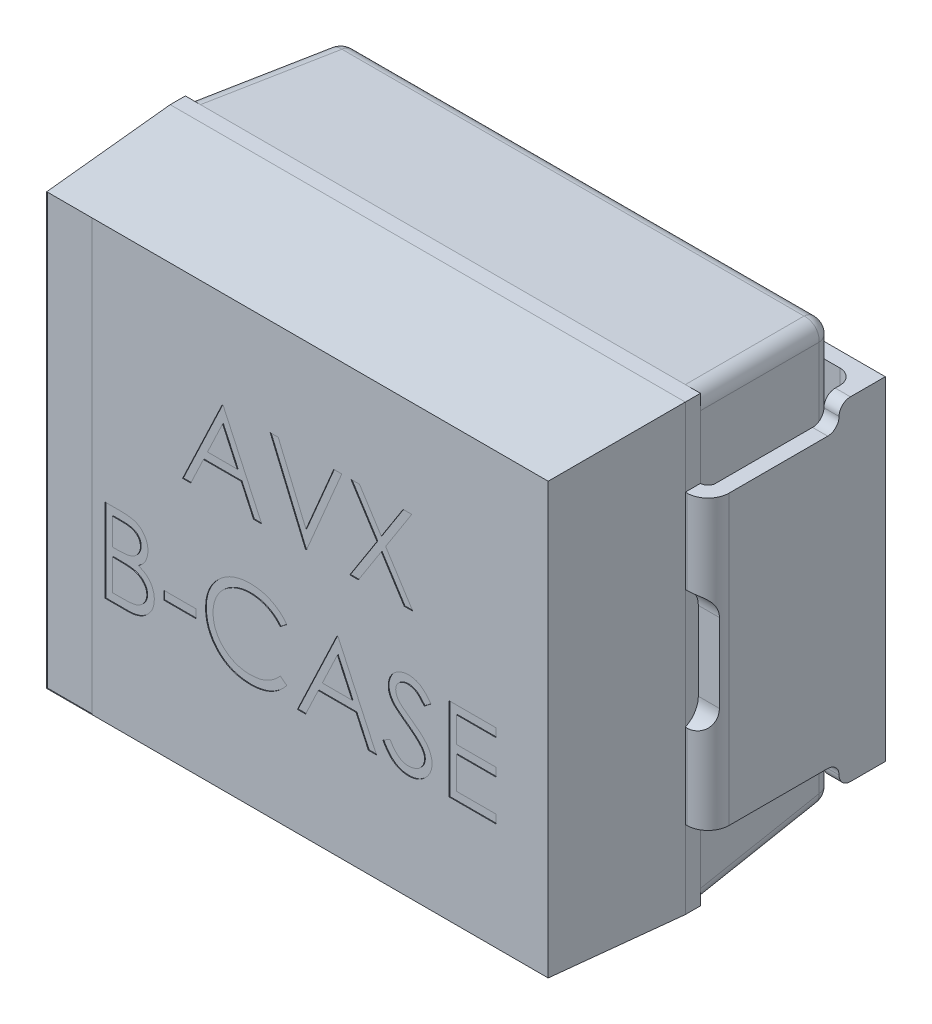
from build123d import *

# Parameters (mm, degrees)
BOSS_EXTRUDE1_START = 0.12
SKETCH1_W           = 3.4
SKETCH1_H           = 2.93
BOSS_EXTRUDE1_DEPTH = 0.95
CHAMFER3_SIZE       = 0.95
CHAMFER3_SIZE_2     = 0.08311423
FILLET4_R           = 0.1
SKETCH2_W           = 3.4
SKETCH2_H           = 2.93
BOSS_EXTRUDE2_DEPTH = 0.1
SKETCH3_W           = 3.4
SKETCH3_H           = 2.93
BOSS_EXTRUDE3_DEPTH = 0.86
BOSS_EXTRUDE3_TAPER = 3
BOSS_EXTRUDE4_START = 0.02
SKETCH4_W           = 1.4
SKETCH4_H           = 2.5
BOSS_EXTRUDE4_DEPTH = 0.1
FILLET5_R           = 0.1
BOSS_EXTRUDE5_DEPTH = 1.1
CUT_EXTRUDE3_DEPTH  = 0.15
CUT_EXTRUDE6_DEPTH  = 0.15
SKETCH15_W          = 0.211538461
SKETCH15_H          = 0.056410256
CUT_EXTRUDE7_DEPTH  = 0.005
SKETCH16_W          = 0.3
SKETCH16_H          = 2.83985862
CUT_EXTRUDE8_DEPTH  = 0.005


# Some blends are built 0.0001 mm under size
with BuildPart() as part:
    # Sketch1 → Boss-Extrude1 (new body)
    with BuildSketch(Plane.XY.offset(BOSS_EXTRUDE1_START)):
        Rectangle(SKETCH1_W, SKETCH1_H)
    extrude(amount=BOSS_EXTRUDE1_DEPTH)

    # Chamfer3
    # the kernel refuses this chamfer: 0.95, 0.08311423 mm, written as the material it takes off along each edge
    with BuildSketch(Plane(origin=(4.169652376, -1.465, 0.12), x_dir=(0, -0.0033526157940331914, 0.9999943799678764), z_dir=(-1, 0, 0)), Plane(origin=(-4.169652376, 1.465, 0.12), x_dir=(0, 0.0033526157940331914, 0.9999943799678764), z_dir=(1, 0, 0))) as chamfer3_piece_1:
        Polygon((CHAMFER3_SIZE * 0.999994379968, CHAMFER3_SIZE * 0.00335261579403), (-CHAMFER3_SIZE_2 * 0.00335261580814, CHAMFER3_SIZE_2 * 0.999994384174), (0, 0), align=None)
    extrude(amount=8.339304752, mode=Mode.SUBTRACT)
    with BuildSketch(Plane(origin=(1.7, 3.934652376, 0.12), x_dir=(0.0033526157940331914, 0, 0.9999943799678764), z_dir=(0, -1, 0)), Plane(origin=(-1.7, -3.934652376, 0.12), x_dir=(-0.0033526157940331914, 0, 0.9999943799678764), z_dir=(0, 1, 0))) as chamfer3_piece_2:
        Polygon((CHAMFER3_SIZE * 0.999994379968, CHAMFER3_SIZE * 0.00335261579403), (-CHAMFER3_SIZE_2 * 0.00335261580814, CHAMFER3_SIZE_2 * 0.999994384174), (0, 0), align=None)
    extrude(amount=7.869304752, mode=Mode.SUBTRACT)

    # Fillet4
    fillet4_edges = [part.edges().sort_by_distance(p)[0] for p in [
        (-1.61688577, 0, 0.12),
        (0, 1.38188577, 0.12),
        (1.61688577, 0, 0.12),
        (0, -1.38188577, 0.12),
        (-1.658442885, 1.423442885, 0.595),
        (1.658442885, 1.423442885, 0.595),
        (-1.658442885, -1.423442885, 0.595),
        (1.658442885, -1.423442885, 0.595),
    ]]
    fillet(fillet4_edges, radius=FILLET4_R)

    # Sketch2 → Boss-Extrude2 (add)
    with BuildSketch(Plane.XY.offset(1.07)):
        Rectangle(SKETCH2_W, SKETCH2_H)
    extrude(amount=BOSS_EXTRUDE2_DEPTH)

    # Sketch3 → Boss-Extrude3 (add)
    with BuildSketch(Plane.XY.offset(1.17)):
        Rectangle(SKETCH3_W, SKETCH3_H)
    extrude(amount=BOSS_EXTRUDE3_DEPTH, taper=BOSS_EXTRUDE3_TAPER)

    # Sketch4 → Boss-Extrude4 (add)
    with BuildSketch(Plane.XY.offset(BOSS_EXTRUDE4_START)):
        Rectangle(SKETCH4_W, SKETCH4_H)
    extrude(amount=BOSS_EXTRUDE4_DEPTH)

    # Fillet5
    fillet5_edges = [part.edges().sort_by_distance(p)[0] for p in [
        (0, -1.25, 0.02),
        (0.7, 0, 0.02),
        (0, 1.25, 0.02),
        (-0.7, 0, 0.02),
    ]]
    fillet(fillet5_edges, radius=FILLET5_R - 0.0001)  # a hair under: the kernel refuses the full size

    # Sketch6 → Boss-Extrude5 (add, symmetric)
    with BuildSketch(Plane(origin=(0, 0, 0), x_dir=(1, 0, 0), z_dir=(0, 1, 0))):
        with BuildLine():
            Line((-1.7, -1.17), (-1.7, -1.07))
            ThreePointArc((-1.7, -1.07), (-1.735648232, -1.055648232), (-1.75, -1.021))
            Line((-1.75, -1.021), (-1.75, -0.2))
            ThreePointArc((-1.75, -0.2), (-1.720710678, -0.129289322), (-1.65, -0.1))
            Line((-1.65, -0.1), (-1.15, -0.1))
            Line((-1.15, -0.1), (-1.15, 0))
            Line((-1.15, 0), (-1.85, 0))
            Line((-1.85, 0), (-1.85, -1.03))
            ThreePointArc((-1.85, -1.03), (-1.808994949, -1.128994949), (-1.71, -1.17))
            Line((-1.71, -1.17), (-1.7, -1.17))
        make_face()
        with BuildLine():
            Line((1.71, -1.17), (1.7, -1.17))
            Line((1.7, -1.17), (1.7, -1.07))
            ThreePointArc((1.7, -1.07), (1.735648232, -1.055648232), (1.75, -1.021))
            Line((1.75, -1.021), (1.75, -0.2))
            ThreePointArc((1.75, -0.2), (1.720710678, -0.129289322), (1.65, -0.1))
            Line((1.65, -0.1), (1.15, -0.1))
            Line((1.15, -0.1), (1.15, 0))
            Line((1.15, 0), (1.85, 0))
            Line((1.85, 0), (1.85, -1.03))
            ThreePointArc((1.85, -1.03), (1.808994949, -1.128994949), (1.71, -1.17))
        make_face()
    extrude(amount=BOSS_EXTRUDE5_DEPTH, both=True)

    # Sketch7 → Cut-Extrude3 (cut)
    with BuildSketch(Plane.ZY.offset(1.85)):
        with BuildLine():
            Line((1.17, 0.475), (0.559, 0.475))
            ThreePointArc((0.559, 0.475), (0.488289322, 0.445710678), (0.459, 0.375))
            Line((0.459, 0.375), (0.459, -0.375))
            ThreePointArc((0.459, -0.375), (0.488289322, -0.445710678), (0.559, -0.475))
            Line((0.559, -0.475), (1.17, -0.475))
            Line((1.17, -0.475), (1.17, 0.475))
        make_face()
    extrude(amount=-CUT_EXTRUDE3_DEPTH, mode=Mode.SUBTRACT)

    # Sketch11 → Cut-Extrude6 (cut)
    with BuildSketch(Plane(origin=(1.7, 0, -3.478843465), x_dir=(0, 0, 1), z_dir=(-1, 0, 0))):
        with BuildLine():
            Line((4.648843465, -1.1), (3.708843465, -1.1))
            ThreePointArc((3.708843465, -1.1), (3.761876473, -1.078033009), (3.783843465, -1.025))
            ThreePointArc((3.783843465, -1.025), (3.805810456, -0.971966991), (3.858843465, -0.95))
            Line((3.858843465, -0.95), (4.648843465, -0.95))
            Line((4.648843465, -0.95), (4.648843465, -1.1))
        make_face()
        with BuildLine():
            Line((4.64771858, 0.392975458), (4.648843465, 0.3935))
            Line((4.648843465, 0.3935), (4.648843465, -0.3935))
            Line((4.648843465, -0.3935), (4.64771858, -0.392975458))
            ThreePointArc((4.64771858, -0.392975458), (4.585864922, -0.338731255), (4.562843465, -0.259748213))
            Line((4.562843465, -0.259748213), (4.562843465, 0.259748213))
            ThreePointArc((4.562843465, 0.259748213), (4.585864922, 0.338731255), (4.64771858, 0.392975458))
        make_face()
        with BuildLine():
            Line((3.858843465, 0.95), (4.648843465, 0.95))
            Line((4.648843465, 0.95), (4.648843465, 1.1))
            Line((4.648843465, 1.1), (3.708843465, 1.1))
            ThreePointArc((3.708843465, 1.1), (3.761876473, 1.078033009), (3.783843465, 1.025))
            ThreePointArc((3.783843465, 1.025), (3.805810456, 0.971966991), (3.858843465, 0.95))
        make_face()
    extrude(amount=-CUT_EXTRUDE6_DEPTH, mode=Mode.SUBTRACT)

    # Sketch15 → Cut-Extrude7 (cut)
    # profile 1 of 9: a face of its own
    with BuildSketch(Plane.XY.offset(2.03)):
        Polygon((-0.490064103, 0.780007225), (-0.236217949, 0.230007225), (-0.289873798, 0.230007225), (-0.371183894, 0.406289277), (-0.620512821, 0.406289277), (-0.704136619, 0.230007225), (-0.758012821, 0.230007225), (-0.497115385, 0.780007225), align=None)
        Polygon((-0.494140625, 0.672805703), (-0.593739984, 0.462699533), (-0.397185497, 0.462699533), align=None, mode=Mode.SUBTRACT)
    # profile 2 of 9: a face of its own
    with BuildSketch(Plane.XY.offset(2.03)):
        Polygon((-0.179807692, 0.780007225), (-0.126923077, 0.780007225), (0.056410256, 0.346573732), (0.23974359, 0.780007225), (0.292628205, 0.780007225), (0.059935897, 0.230007225), (0.052884615, 0.230007225), align=None)
    # profile 3 of 9: a face of its own
    with BuildSketch(Plane.XY.offset(2.03)):
        Polygon((0.352564103, 0.780007225), (0.40952524, 0.780007225), (0.553525641, 0.555027257), (0.697526042, 0.780007225), (0.754487179, 0.780007225), (0.582061298, 0.510516039), (0.761538462, 0.230007225), (0.704577324, 0.230007225), (0.553525641, 0.466004821), (0.402473958, 0.230007225), (0.345512821, 0.230007225), (0.52510016, 0.510516039), align=None)
    # profile 4 of 9: a face of its own
    with BuildSketch(Plane.XY.offset(2.03)):
        with BuildLine():
            Line((-1.269230769, -0.161659441), (-1.161919071, -0.161659441))
            add(Edge.make_bspline(
                [(-1.161919071, -0.161659441), (-1.156666024, -0.161687059), (-1.146484312, -0.16174059), (-1.1316784, -0.162570796), (-1.11781073, -0.163702801), (-1.10487728, -0.165498959), (-1.092884027, -0.167666238), (-1.081794826, -0.170290809), (-1.071644942, -0.173437848), (-1.059527227, -0.178442264), (-1.045711123, -0.185878762), (-1.030751375, -0.196867536), (-1.017959281, -0.210308352), (-1.006930002, -0.225469912), (-0.998161255, -0.242148391), (-0.991817508, -0.259946263), (-0.98780127, -0.278633965), (-0.987388231, -0.291463608), (-0.987179487, -0.297947502)],
                knots=[0, 0, 0, 0, 1.001505555, 1.941167018, 2.826882275, 3.653841531, 4.429895133, 5.150066043, 5.825578002, 6.45369114, 7.647487171, 8.808567382, 9.977351308, 11.170798116, 12.373658725, 13.556498008, 14.765093433, 16, 16, 16, 16], degree=3))
            add(Edge.make_bspline(
                [(-0.987179487, -0.297947502), (-0.987351279, -0.304021475), (-0.987688865, -0.315957405), (-0.990917013, -0.333415051), (-0.995970832, -0.3500331), (-1.002995943, -0.365750903), (-1.012126257, -0.380213328), (-1.02294685, -0.393537041), (-1.036001776, -0.405157922), (-1.045782856, -0.411654663), (-1.050751202, -0.414954714)],
                knots=[0, 0, 0, 0, 1.044552857, 2.05264487, 3.044412934, 4.028983338, 5.005914585, 5.980388656, 6.974128949, 8, 8, 8, 8], degree=3))
            add(Edge.make_bspline(
                [(-1.050751202, -0.414954714), (-1.044503135, -0.417353499), (-1.032549034, -0.42194297), (-1.016098375, -0.430057115), (-1.0019249, -0.438882589), (-0.989919634, -0.448520451), (-0.979652288, -0.458908979), (-0.970686826, -0.470200497), (-0.963036896, -0.482542302), (-0.956482008, -0.495805714), (-0.951367203, -0.509855302), (-0.947536704, -0.524559281), (-0.945341819, -0.539864926), (-0.945029475, -0.5502812), (-0.944871795, -0.55553965)],
                knots=[0, 0, 0, 0, 1.27268992, 2.434971085, 3.483601985, 4.442670788, 5.356604649, 6.2567628, 7.179492994, 8.113709626, 9.066344395, 10.018646069, 10.999752585, 12, 12, 12, 12], degree=3))
            add(Edge.make_bspline(
                [(-0.944871795, -0.55553965), (-0.945025299, -0.56090873), (-0.945327323, -0.571472545), (-0.947555605, -0.586991209), (-0.951328464, -0.601821558), (-0.956525359, -0.616059515), (-0.963308008, -0.629677536), (-0.971562403, -0.642691049), (-0.981404505, -0.654969301), (-0.992414385, -0.666648727), (-1.004869865, -0.677150237), (-1.018308055, -0.686502705), (-1.032898191, -0.694194229), (-1.048400647, -0.700655318), (-1.064989325, -0.705590735), (-1.082589735, -0.709043568), (-1.101186697, -0.711370074), (-1.113948229, -0.711561349), (-1.120492788, -0.711659441)],
                knots=[0, 0, 0, 0, 0.978564426, 1.925352924, 2.850884081, 3.763762016, 4.682927383, 5.618979971, 6.567305752, 7.547517671, 8.540179244, 9.531824382, 10.526200242, 11.540722885, 12.589160233, 13.674978461, 14.80764778, 16, 16, 16, 16], degree=3))
            Line((-1.120492788, -0.711659441), (-1.269230769, -0.711659441))
            Line((-1.269230769, -0.711659441), (-1.269230769, -0.161659441))
        make_face()
        with BuildLine():
            Line((-1.219871795, -0.218069698), (-1.219871795, -0.394351749))
            Line((-1.219871795, -0.394351749), (-1.186708734, -0.394351749))
            add(Edge.make_bspline(
                [(-1.186708734, -0.394351749), (-1.181861066, -0.394288904), (-1.172494384, -0.394167475), (-1.158929829, -0.393819636), (-1.146338755, -0.392845658), (-1.134742895, -0.39187196), (-1.124160511, -0.39028881), (-1.114615047, -0.388404334), (-1.105956696, -0.386411306), (-1.09597191, -0.383021815), (-1.084646161, -0.378012466), (-1.072572388, -0.37023832), (-1.0619284, -0.360978779), (-1.05294027, -0.350294485), (-1.045584182, -0.338529799), (-1.040474884, -0.325872432), (-1.037010311, -0.31263784), (-1.036697356, -0.303552114), (-1.036538462, -0.298939089)],
                knots=[0, 0, 0, 0, 1.156816544, 2.235205308, 3.236616184, 4.169592532, 5.011045266, 5.787822928, 6.49130361, 7.128639758, 8.301311294, 9.436451833, 10.541879658, 11.654887649, 12.756523258, 13.837046038, 14.901820046, 16, 16, 16, 16], degree=3))
            add(Edge.make_bspline(
                [(-1.036538462, -0.298939089), (-1.036621147, -0.295886468), (-1.036783344, -0.289898418), (-1.03811172, -0.281169233), (-1.040369481, -0.272959501), (-1.043269442, -0.265156712), (-1.04732195, -0.25800485), (-1.052093351, -0.251256634), (-1.057858246, -0.245141872), (-1.064420109, -0.239426665), (-1.071964321, -0.234359668), (-1.080486381, -0.229921834), (-1.090101588, -0.226348283), (-1.100647893, -0.223218602), (-1.112287636, -0.221020442), (-1.124886494, -0.219189195), (-1.138547664, -0.218256907), (-1.147999038, -0.218133493), (-1.152884615, -0.218069698)],
                knots=[0, 0, 0, 0, 0.91205012, 1.789085906, 2.630437955, 3.453916878, 4.269457761, 5.079663411, 5.91843418, 6.774407191, 7.675494373, 8.627863946, 9.638891023, 10.736472738, 11.911756761, 13.175263542, 14.539845004, 16, 16, 16, 16], degree=3))
            Line((-1.152884615, -0.218069698), (-1.219871795, -0.218069698))
        make_face(mode=Mode.SUBTRACT)
        with BuildLine():
            Line((-1.219871795, -0.450762006), (-1.219871795, -0.655249185))
            Line((-1.219871795, -0.655249185), (-1.149579327, -0.655249185))
            add(Edge.make_bspline(
                [(-1.149579327, -0.655249185), (-1.144547781, -0.655188882), (-1.134850141, -0.655072655), (-1.120848519, -0.654693225), (-1.107871174, -0.653830154), (-1.095977324, -0.65247152), (-1.085038539, -0.650997764), (-1.075186043, -0.649015991), (-1.066339969, -0.64674544), (-1.056082578, -0.643235784), (-1.044532027, -0.637783482), (-1.032084606, -0.629562675), (-1.021017629, -0.619769012), (-1.01161966, -0.608434154), (-1.003917619, -0.596109231), (-0.998314619, -0.583043534), (-0.994858913, -0.569452951), (-0.994440572, -0.560186753), (-0.994230769, -0.55553965)],
                knots=[0, 0, 0, 0, 1.160039823, 2.235823828, 3.228722157, 4.157150951, 4.99529583, 5.772374946, 6.472645482, 7.099169577, 8.269452708, 9.405989375, 10.527446681, 11.663510218, 12.788923519, 13.866172445, 14.929861265, 16, 16, 16, 16], degree=3))
            add(Edge.make_bspline(
                [(-0.994230769, -0.55553965), (-0.994274157, -0.552633553), (-0.994360233, -0.546868236), (-0.995658329, -0.53839575), (-0.997546223, -0.530188827), (-0.999986877, -0.522225182), (-1.003541365, -0.514648795), (-1.007690965, -0.507309821), (-1.012556328, -0.50019856), (-1.020137554, -0.491208063), (-1.03116458, -0.480849675), (-1.046832788, -0.470708068), (-1.064648435, -0.462529127), (-1.077569898, -0.459056352), (-1.084244792, -0.457262406)],
                knots=[0, 0, 0, 0, 0.723448775, 1.435228256, 2.130040452, 2.821711965, 3.505591119, 4.210454504, 4.921174351, 5.648778258, 7.137944449, 8.670945889, 10.280296675, 12, 12, 12, 12], degree=3))
            add(Edge.make_bspline(
                [(-1.084244792, -0.457262406), (-1.086920792, -0.456719464), (-1.092722914, -0.455542255), (-1.102184105, -0.454299616), (-1.112985456, -0.453192535), (-1.125151908, -0.452373638), (-1.138698855, -0.451527182), (-1.153655228, -0.451197995), (-1.169959949, -0.450805255), (-1.181273036, -0.450776791), (-1.187149439, -0.450762006)],
                knots=[0, 0, 0, 0, 0.634451884, 1.375622551, 2.216452059, 3.157844607, 4.20941857, 5.370758133, 6.634282058, 8, 8, 8, 8], degree=3))
            Line((-1.187149439, -0.450762006), (-1.219871795, -0.450762006))
        make_face(mode=Mode.SUBTRACT)
    # profile 5 of 9: a face of its own
    with BuildSketch(Plane.XY.offset(2.03)):
        with Locations((-0.775641026, -0.50012098)):
            Rectangle(SKETCH15_W, SKETCH15_H)
    # profile 6 of 9: a face of its own
    with BuildSketch(Plane.XY.offset(2.03)):
        with BuildLine():
            Line((-0.070512821, -0.262580916), (-0.113701923, -0.2956338))
            add(Edge.make_bspline(
                [(-0.113701923, -0.2956338), (-0.116782848, -0.291962005), (-0.122903161, -0.284667918), (-0.132749608, -0.274425419), (-0.143011294, -0.264829449), (-0.153684299, -0.255834296), (-0.164960732, -0.247754519), (-0.176567429, -0.24016906), (-0.18869855, -0.233369844), (-0.205473823, -0.22512566), (-0.227418485, -0.216522693), (-0.255043388, -0.209309328), (-0.283880847, -0.204717429), (-0.303554755, -0.204220097), (-0.313561699, -0.203967134)],
                knots=[0, 0, 0, 0, 0.757959112, 1.505699292, 2.245454638, 2.979532153, 3.711538275, 4.438200793, 5.171680507, 5.909471876, 7.393775596, 8.890124382, 10.418191784, 12, 12, 12, 12], degree=3))
            add(Edge.make_bspline(
                [(-0.313561699, -0.203967134), (-0.319074789, -0.204030614), (-0.330049802, -0.204156984), (-0.346337419, -0.205824132), (-0.362320898, -0.208167322), (-0.377989843, -0.211644159), (-0.393324308, -0.216039856), (-0.408424543, -0.221292421), (-0.423071923, -0.227791039), (-0.437469074, -0.234973766), (-0.45126295, -0.24308665), (-0.464314458, -0.251935891), (-0.476575996, -0.261422463), (-0.488057263, -0.271581923), (-0.498769998, -0.282368516), (-0.508636575, -0.293897199), (-0.517622854, -0.306131112), (-0.525906958, -0.318908933), (-0.533326102, -0.332193443), (-0.53953794, -0.346033811), (-0.545038745, -0.360193027), (-0.549391483, -0.374831067), (-0.552836764, -0.38984493), (-0.555213969, -0.405274911), (-0.556862157, -0.421088775), (-0.556987899, -0.431807381), (-0.557051282, -0.437210323)],
                knots=[0, 0, 0, 0, 1.054917814, 2.100044995, 3.131103042, 4.146048494, 5.169673617, 6.183595914, 7.203665975, 8.234915748, 9.262203917, 10.264457458, 11.251630812, 12.227803204, 13.197192746, 14.159520551, 15.12972552, 16.100847026, 17.073214652, 18.039054194, 19.002613845, 19.979014051, 20.95965708, 21.949030935, 22.966165397, 24, 24, 24, 24], degree=3))
            add(Edge.make_bspline(
                [(-0.557051282, -0.437210323), (-0.556852996, -0.44533953), (-0.556463688, -0.461300151), (-0.55299895, -0.48467839), (-0.547733864, -0.507074495), (-0.539842845, -0.528348471), (-0.530112709, -0.548762641), (-0.517817755, -0.567971604), (-0.503578014, -0.586265635), (-0.487192033, -0.603212384), (-0.469213977, -0.618693113), (-0.449925019, -0.632325347), (-0.429373203, -0.643689114), (-0.407785446, -0.653145334), (-0.384995628, -0.660414249), (-0.361044731, -0.665531468), (-0.335984846, -0.668869525), (-0.318861083, -0.669189104), (-0.310146234, -0.669351749)],
                knots=[0, 0, 0, 0, 1.029171465, 2.020641659, 2.987623507, 3.938342917, 4.889210282, 5.84687017, 6.821220943, 7.821438502, 8.827599549, 9.822697543, 10.807740252, 11.797342354, 12.80366471, 13.83203677, 14.896651826, 16, 16, 16, 16], degree=3))
            add(Edge.make_bspline(
                [(-0.310146234, -0.669351749), (-0.300544383, -0.669086369), (-0.281645643, -0.668564039), (-0.253930667, -0.664139014), (-0.227399333, -0.656964198), (-0.202050212, -0.646923096), (-0.177954768, -0.633869979), (-0.155075292, -0.618046027), (-0.133392474, -0.599300718), (-0.12035413, -0.584987655), (-0.113701923, -0.577685082)],
                knots=[0, 0, 0, 0, 1.028121516, 2.023589091, 2.998037872, 3.967518031, 4.937445131, 5.927275754, 6.942489185, 8, 8, 8, 8], degree=3))
            Line((-0.113701923, -0.577685082), (-0.070512821, -0.610407438))
            add(Edge.make_bspline(
                [(-0.070512821, -0.610407438), (-0.073988523, -0.614892052), (-0.080923281, -0.623839799), (-0.092152398, -0.636453925), (-0.103981688, -0.648318844), (-0.116499013, -0.659338899), (-0.129560381, -0.669734601), (-0.143400315, -0.679210603), (-0.157836878, -0.687899171), (-0.172821153, -0.69585483), (-0.188337221, -0.702913255), (-0.204366489, -0.70895599), (-0.220839865, -0.714161329), (-0.237758102, -0.718443777), (-0.255156293, -0.721786375), (-0.272971653, -0.724020896), (-0.291242633, -0.725551768), (-0.303569142, -0.725691298), (-0.309815705, -0.725762006)],
                knots=[0, 0, 0, 0, 0.986787822, 1.968848986, 2.935600012, 3.899624008, 4.868462664, 5.837806735, 6.815139263, 7.798259679, 8.787526145, 9.778297419, 10.776456485, 11.791383307, 12.812564526, 13.85620153, 14.913611965, 16, 16, 16, 16], degree=3))
            add(Edge.make_bspline(
                [(-0.309815705, -0.725762006), (-0.315731139, -0.725720835), (-0.327428176, -0.725639426), (-0.344697979, -0.724320657), (-0.361510628, -0.722521413), (-0.377818069, -0.719812249), (-0.393709294, -0.716615281), (-0.409040243, -0.712329798), (-0.423961776, -0.707529215), (-0.438413944, -0.701887003), (-0.452409039, -0.695520174), (-0.465901924, -0.688324358), (-0.478886392, -0.680360065), (-0.491490101, -0.671802849), (-0.503526864, -0.662377844), (-0.515100989, -0.652215944), (-0.526277378, -0.6413514), (-0.533192086, -0.633517066), (-0.53666867, -0.629578111)],
                knots=[0, 0, 0, 0, 1.114604814, 2.203992996, 3.262667896, 4.300477797, 5.318619304, 6.316056647, 7.298880507, 8.271930387, 9.238335007, 10.195173496, 11.151986948, 12.108099108, 13.064862484, 14.031167946, 15.010108607, 16, 16, 16, 16], degree=3))
            add(Edge.make_bspline(
                [(-0.53666867, -0.629578111), (-0.542237128, -0.622735924), (-0.553306817, -0.609134156), (-0.567469425, -0.587089216), (-0.579592612, -0.564072783), (-0.589394542, -0.539963937), (-0.597057258, -0.514816776), (-0.602365731, -0.488618624), (-0.605815269, -0.461393947), (-0.606209743, -0.442876738), (-0.606410256, -0.433464329)],
                knots=[0, 0, 0, 0, 0.994628077, 1.977248131, 2.950237994, 3.925870899, 4.908910175, 5.911660606, 6.938484602, 8, 8, 8, 8], degree=3))
            add(Edge.make_bspline(
                [(-0.606410256, -0.433464329), (-0.606165869, -0.423571329), (-0.605685052, -0.40410747), (-0.601599998, -0.375542991), (-0.595028473, -0.348176343), (-0.585694676, -0.322058612), (-0.573860978, -0.297052425), (-0.55924251, -0.273348807), (-0.542009102, -0.250796167), (-0.522295913, -0.229736706), (-0.500678189, -0.210480522), (-0.477528089, -0.193539547), (-0.452890926, -0.17944108), (-0.427038121, -0.167655969), (-0.399776085, -0.158597554), (-0.371162985, -0.152256339), (-0.341252584, -0.148309363), (-0.320845631, -0.147810402), (-0.310476763, -0.147556877)],
                knots=[0, 0, 0, 0, 1.032925535, 2.032216505, 3.007276963, 3.968222605, 4.92396291, 5.891752235, 6.871517503, 7.883894988, 8.900124299, 9.891468569, 10.874487609, 11.85992873, 12.854644235, 13.869047385, 14.917252991, 16, 16, 16, 16], degree=3))
            add(Edge.make_bspline(
                [(-0.310476763, -0.147556877), (-0.304157346, -0.147632642), (-0.291648696, -0.14778261), (-0.273144708, -0.149245004), (-0.255129485, -0.151682856), (-0.237590617, -0.155001096), (-0.220442777, -0.159119389), (-0.203817025, -0.164484293), (-0.187615803, -0.170618605), (-0.171941288, -0.177683507), (-0.156868688, -0.185613995), (-0.142402695, -0.194322165), (-0.128658217, -0.20379722), (-0.115538541, -0.213958576), (-0.103263136, -0.225021207), (-0.091483475, -0.236680829), (-0.080599592, -0.249273287), (-0.073881232, -0.258136919), (-0.070512821, -0.262580916)],
                knots=[0, 0, 0, 0, 1.096760587, 2.17092713, 3.219439832, 4.250915756, 5.268269357, 6.278326846, 7.281116186, 8.274029601, 9.260640565, 10.235837813, 11.203064059, 12.156899882, 13.114053108, 14.069676657, 15.032185724, 16, 16, 16, 16], degree=3))
        make_face()
    # profile 7 of 9: a face of its own
    with BuildSketch(Plane.XY.offset(2.03)):
        Polygon((0.267948718, -0.161659441), (0.521794872, -0.711659441), (0.468139022, -0.711659441), (0.386828926, -0.53537739), (0.1375, -0.53537739), (0.053876202, -0.711659441), (0, -0.711659441), (0.260897436, -0.161659441), align=None)
        Polygon((0.263872196, -0.268860964), (0.164272837, -0.478967134), (0.360827324, -0.478967134), align=None, mode=Mode.SUBTRACT)
    # profile 8 of 9: a face of its own
    with BuildSketch(Plane.XY.offset(2.03)):
        with BuildLine():
            Line((0.564102564, -0.605559682), (0.610596955, -0.577685082))
            add(Edge.make_bspline(
                [(0.610596955, -0.577685082), (0.61492125, -0.584923771), (0.623206431, -0.59879282), (0.637027359, -0.61753337), (0.651348245, -0.633461709), (0.66627514, -0.646485175), (0.681716932, -0.656738572), (0.697774426, -0.663998923), (0.714393511, -0.668527147), (0.725703682, -0.669077161), (0.73135016, -0.669351749)],
                knots=[0, 0, 0, 0, 1.272034388, 2.437168799, 3.508375237, 4.49857839, 5.41946034, 6.295179144, 7.148887113, 8, 8, 8, 8], degree=3))
            add(Edge.make_bspline(
                [(0.73135016, -0.669351749), (0.736172381, -0.669217443), (0.745732446, -0.668951182), (0.759806512, -0.66639277), (0.773475081, -0.662462293), (0.786456439, -0.656833289), (0.798571464, -0.650022956), (0.809195373, -0.641797128), (0.818379762, -0.632587581), (0.825892623, -0.622313164), (0.831656629, -0.611263327), (0.836086811, -0.599921391), (0.838545322, -0.588109188), (0.838915669, -0.580156115), (0.839102564, -0.576142614)],
                knots=[0, 0, 0, 0, 1.095163259, 2.171163733, 3.241058638, 4.321873601, 5.38011039, 6.391990106, 7.366004449, 8.327778327, 9.272591725, 10.192022065, 11.087607919, 12, 12, 12, 12], degree=3))
            add(Edge.make_bspline(
                [(0.839102564, -0.576142614), (0.838870887, -0.571563338), (0.83839992, -0.562254338), (0.834419259, -0.548520107), (0.828157235, -0.534928418), (0.822380248, -0.526521076), (0.81938101, -0.522156236)],
                knots=[0, 0, 0, 0, 0.938893495, 1.908633276, 2.914225137, 4, 4, 4, 4], degree=3))
            add(Edge.make_bspline(
                [(0.81938101, -0.522156236), (0.816918485, -0.519006021), (0.811748721, -0.512392539), (0.802861112, -0.502548287), (0.792432151, -0.492393964), (0.780818735, -0.481541827), (0.767597821, -0.470496602), (0.753183498, -0.458731586), (0.737207749, -0.446694196), (0.726003542, -0.438621364), (0.720222356, -0.434455916)],
                knots=[0, 0, 0, 0, 0.722233717, 1.516239348, 2.393582979, 3.351407094, 4.387010283, 5.505090956, 6.712668013, 8, 8, 8, 8], degree=3))
            add(Edge.make_bspline(
                [(0.720222356, -0.434455916), (0.714435728, -0.430334281), (0.703372136, -0.422454028), (0.687900073, -0.410758783), (0.674064514, -0.400066175), (0.661926955, -0.390275545), (0.651492732, -0.381385564), (0.642679625, -0.373481602), (0.635712137, -0.3663499), (0.631837689, -0.361723403), (0.630098157, -0.35964622)],
                knots=[0, 0, 0, 0, 1.452282411, 2.77665338, 3.964542531, 5.026858415, 5.96415736, 6.766646006, 7.446254459, 8, 8, 8, 8], degree=3))
            add(Edge.make_bspline(
                [(0.630098157, -0.35964622), (0.627666757, -0.356408914), (0.622885083, -0.350042318), (0.616573282, -0.340091269), (0.611208556, -0.329904756), (0.607003047, -0.319455406), (0.603461641, -0.308889917), (0.601079681, -0.298070435), (0.599588175, -0.28704551), (0.599435435, -0.279626245), (0.599358974, -0.275912246)],
                knots=[0, 0, 0, 0, 1.068054152, 2.10047183, 3.106115577, 4.101338837, 5.06977816, 6.043150881, 7.020423561, 8, 8, 8, 8], degree=3))
            add(Edge.make_bspline(
                [(0.599358974, -0.275912246), (0.599564079, -0.270093281), (0.599969903, -0.258579728), (0.603401984, -0.241760598), (0.608819153, -0.225702732), (0.61640835, -0.210565109), (0.626191648, -0.196741883), (0.637513159, -0.184074049), (0.650997821, -0.173424701), (0.665793233, -0.164119949), (0.681987806, -0.156837018), (0.698957805, -0.151343149), (0.716730202, -0.148230266), (0.728767837, -0.147783546), (0.734875801, -0.147556877)],
                knots=[0, 0, 0, 0, 1.005424448, 1.989358655, 2.955360095, 3.929531133, 4.905563448, 5.876582895, 6.856512386, 7.866279853, 8.892233794, 9.918561126, 10.94386622, 12, 12, 12, 12], degree=3))
            add(Edge.make_bspline(
                [(0.734875801, -0.147556877), (0.741357017, -0.147780421), (0.754246087, -0.148224978), (0.773205249, -0.152090305), (0.791459076, -0.158486125), (0.806143018, -0.165744342), (0.817635309, -0.172993565), (0.826399595, -0.17959668), (0.835280909, -0.187198483), (0.844350889, -0.195819221), (0.85345585, -0.205537997), (0.862730964, -0.216288248), (0.87219792, -0.228004278), (0.878288127, -0.236368128), (0.881410256, -0.240655836)],
                knots=[0, 0, 0, 0, 1.286793592, 2.559021753, 3.825965368, 5.121522368, 5.803751409, 6.523245864, 7.299691795, 8.125521123, 9.008227632, 9.944561021, 10.946284179, 12, 12, 12, 12], degree=3))
            Line((0.881410256, -0.240655836), (0.836788862, -0.274479954))
            add(Edge.make_bspline(
                [(0.836788862, -0.274479954), (0.834094501, -0.271008874), (0.828905792, -0.264324386), (0.821028302, -0.254963179), (0.813603514, -0.246412018), (0.806288451, -0.238984641), (0.799469452, -0.232274306), (0.79285106, -0.226529201), (0.786528519, -0.221693036), (0.778558719, -0.216531905), (0.768545934, -0.211415883), (0.755976936, -0.207086742), (0.74284195, -0.204485233), (0.733895865, -0.204141265), (0.729366987, -0.203967134)],
                knots=[0, 0, 0, 0, 1.181633172, 2.275549214, 3.290209073, 4.226197932, 5.078386478, 5.862611352, 6.581680152, 7.217281963, 8.414376989, 9.595101626, 10.782541182, 12, 12, 12, 12], degree=3))
            add(Edge.make_bspline(
                [(0.729366987, -0.203967134), (0.723685248, -0.204157544), (0.712728549, -0.204524731), (0.697172941, -0.208535015), (0.683172467, -0.214849307), (0.671142778, -0.223698804), (0.661126967, -0.234183531), (0.653881824, -0.24624878), (0.649521083, -0.259571729), (0.648988954, -0.268865418), (0.648717949, -0.273598544)],
                knots=[0, 0, 0, 0, 1.14458467, 2.207223713, 3.21896685, 4.227309161, 5.202851033, 6.127160689, 7.046193047, 8, 8, 8, 8], degree=3))
            add(Edge.make_bspline(
                [(0.648717949, -0.273598544), (0.648779726, -0.276545205), (0.648903381, -0.282443345), (0.650627992, -0.29115714), (0.652843601, -0.299848922), (0.656354586, -0.308479613), (0.661201705, -0.317200156), (0.667566804, -0.326160714), (0.675583182, -0.335440269), (0.681723855, -0.341475713), (0.684965946, -0.344662246)],
                knots=[0, 0, 0, 0, 0.858281714, 1.717966888, 2.583508476, 3.4729293, 4.427298488, 5.488583878, 6.674047936, 8, 8, 8, 8], degree=3))
            add(Edge.make_bspline(
                [(0.684965946, -0.344662246), (0.686169875, -0.345736636), (0.689030137, -0.34828914), (0.694259211, -0.352467927), (0.701164508, -0.357622648), (0.709565711, -0.364000655), (0.719617725, -0.37139917), (0.731321656, -0.379723595), (0.744547039, -0.389244167), (0.753931912, -0.395900352), (0.758894231, -0.399419858)],
                knots=[0, 0, 0, 0, 0.420754252, 0.999615792, 1.744751191, 2.668019286, 3.750313428, 4.999500688, 6.413464383, 8, 8, 8, 8], degree=3))
            add(Edge.make_bspline(
                [(0.758894231, -0.399419858), (0.764863446, -0.4037635), (0.776422003, -0.412174361), (0.792868194, -0.424811111), (0.807780078, -0.437170046), (0.82121001, -0.449172242), (0.833290667, -0.460726656), (0.843888024, -0.471972299), (0.853110059, -0.482828603), (0.863038222, -0.496747151), (0.873183022, -0.513841321), (0.881895259, -0.534785044), (0.887388714, -0.55581018), (0.888107095, -0.56994154), (0.888461538, -0.576913848)],
                knots=[0, 0, 0, 0, 1.163667725, 2.253281268, 3.268753668, 4.215851969, 5.092017293, 5.902905408, 6.650798638, 7.335211899, 8.59617414, 9.77448103, 10.901945474, 12, 12, 12, 12], degree=3))
            add(Edge.make_bspline(
                [(0.888461538, -0.576913848), (0.888358274, -0.581844734), (0.88815375, -0.591610752), (0.885802749, -0.605950835), (0.882358231, -0.619878543), (0.877166665, -0.633221718), (0.870830169, -0.646224467), (0.862789759, -0.658545708), (0.85346998, -0.670458142), (0.842778959, -0.681644119), (0.831080318, -0.691912807), (0.818715737, -0.701047374), (0.80566498, -0.708663825), (0.791998844, -0.714878957), (0.777714191, -0.719739939), (0.762815825, -0.723261961), (0.747279188, -0.725423573), (0.736719112, -0.725647935), (0.73135016, -0.725762006)],
                knots=[0, 0, 0, 0, 0.983748083, 1.948392443, 2.894712957, 3.844097841, 4.80183111, 5.778335162, 6.776009319, 7.81870978, 8.863265674, 9.881300176, 10.883814829, 11.87499822, 12.874611388, 13.892143829, 14.928324115, 16, 16, 16, 16], degree=3))
            add(Edge.make_bspline(
                [(0.73135016, -0.725762006), (0.727196035, -0.725681677), (0.718940101, -0.725522032), (0.706728611, -0.724110687), (0.694763819, -0.722113857), (0.68319586, -0.718943646), (0.671875695, -0.715097264), (0.660852558, -0.71036124), (0.650121107, -0.70468568), (0.639621201, -0.698196462), (0.629379545, -0.69064453), (0.6194922, -0.681848695), (0.609634757, -0.672051545), (0.600098166, -0.660987027), (0.590689529, -0.6488339), (0.58159435, -0.635478457), (0.572624366, -0.620993444), (0.566996221, -0.610800359), (0.564102564, -0.605559682)],
                knots=[0, 0, 0, 0, 0.915332311, 1.819136955, 2.706846663, 3.586547465, 4.459518054, 5.340707479, 6.227863349, 7.133153174, 8.059268498, 9.028702269, 10.047606654, 11.120612155, 12.245963614, 13.433783089, 14.680604001, 16, 16, 16, 16], degree=3))
        make_face()
    # profile 9 of 9: a face of its own
    with BuildSketch(Plane.XY.offset(2.03)):
        Polygon((1.001282051, -0.161659441), (1.311538462, -0.161659441), (1.311538462, -0.218069698), (1.050641026, -0.218069698), (1.050641026, -0.387300467), (1.311538462, -0.387300467), (1.311538462, -0.443710723), (1.050641026, -0.443710723), (1.050641026, -0.655249185), (1.311538462, -0.655249185), (1.311538462, -0.711659441), (1.001282051, -0.711659441), align=None)
    extrude(amount=-CUT_EXTRUDE7_DEPTH, mode=Mode.SUBTRACT)

    # Sketch16 → Cut-Extrude8 (cut)
    with BuildSketch(Plane.XY.offset(2.03)):
        with Locations((-1.50492931, 0)):
            Rectangle(SKETCH16_W, SKETCH16_H)
    extrude(amount=-CUT_EXTRUDE8_DEPTH, mode=Mode.SUBTRACT)


solid = part.part
